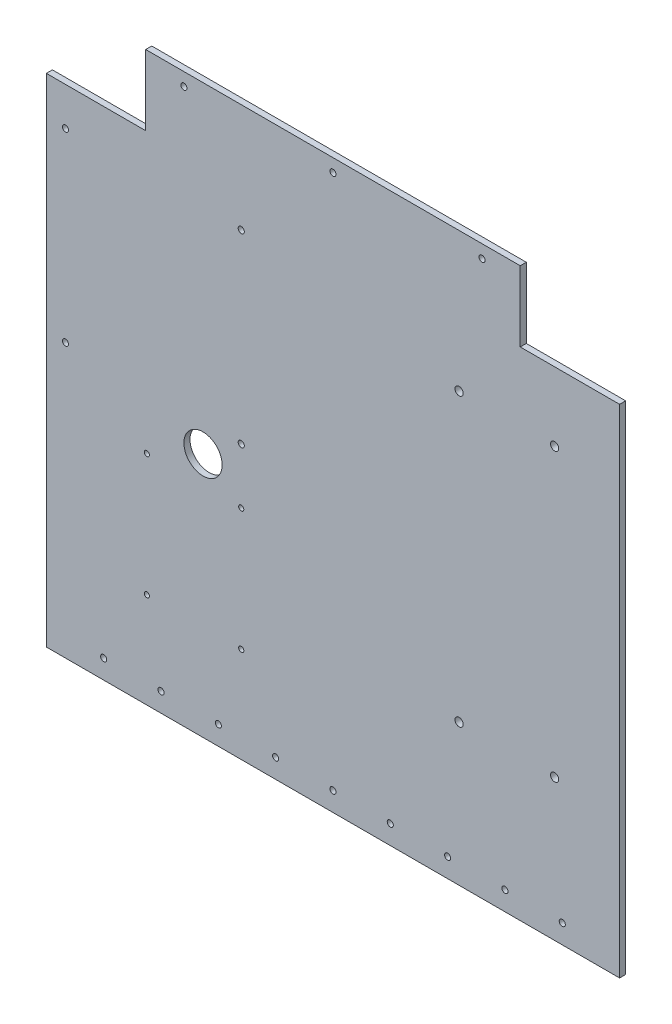
from build123d import *

# Parameters (mm, degrees)
SKETCH1_W                    = 300
SKETCH1_H                    = 300
BOSS_EXTRUDE1_DEPTH          = 3.175
SKETCH2_W                    = 52
SKETCH2_H                    = 40
CUT_EXTRUDE1_DEPTH           = 10
M4_START                     = -3.175
M4_CLEARANCE_HOLE1_OUTLINE_R = 2.15
M4_CLEARANCE_HOLE1_DEPTH     = 3.175
M3_CLEARANCE_HOLE2_D         = 3.2
M2_5_CLEARANCE_HOLE1_D       = 2.7
M3_CLEARANCE_HOLE3_D         = 3.2
M3_CLEARANCE_HOLE4_D         = 3.2
SKETCH14_R                   = 10
CUT_EXTRUDE2_DEPTH           = 10
SKETCH5_W                    = 196
SKETCH5_H                    = 3.2
CUT_EXTRUDE3_DEPTH           = 10


# Read off the part's stored shape, not the designer's step: M4 Clearance Hole1
with BuildPart() as part:
    # Sketch1 → Boss-Extrude1 (new body)
    with BuildSketch(Plane(origin=(0, 0, 0), x_dir=(1, 0, 0), z_dir=(0, 0, -1))):
        with Locations((150, 150)):
            Rectangle(SKETCH1_W, SKETCH1_H)
    extrude(amount=BOSS_EXTRUDE1_DEPTH)

    # Sketch2 → Cut-Extrude1 (cut)
    with BuildSketch(Plane(origin=(0, 0, -3.175), x_dir=(1, 0, 0), z_dir=(0, 0, -1))):
        with Locations((26, 20)):
            Rectangle(SKETCH2_W, SKETCH2_H)
        with Locations((274, 20)):
            Rectangle(SKETCH2_W, SKETCH2_H)
    extrude(amount=-CUT_EXTRUDE1_DEPTH, mode=Mode.SUBTRACT)

    # M4 Clearance Hole1 outline → M4 Clearance Hole1 (cut)
    with BuildSketch(Plane.XY.offset(M4_START)):
        with Locations((266, -226)):
            Circle(M4_CLEARANCE_HOLE1_OUTLINE_R)
        with Locations((216, -76)):
            Circle(M4_CLEARANCE_HOLE1_OUTLINE_R)
        with Locations((216, -226)):
            Circle(M4_CLEARANCE_HOLE1_OUTLINE_R)
        with Locations((266, -76)):
            Circle(M4_CLEARANCE_HOLE1_OUTLINE_R)
    extrude(amount=M4_CLEARANCE_HOLE1_DEPTH, mode=Mode.SUBTRACT)

    # M3 Clearance Hole2 (through all)
    with Locations(Plane(origin=(0, 0, -3.175), x_dir=(-1, 0, 0), z_dir=(0, 0, -1))):
        with Locations((-102, -60), (-10, -157), (-102, -157), (-10, -60)):
            Hole(M3_CLEARANCE_HOLE2_D / 2)

    # M2.5 Clearance Hole1 (through all)
    with Locations(Plane(origin=(0, 0, -3.175), x_dir=(-1, 0, 0), z_dir=(0, 0, -1))):
        with Locations((-102, -186), (-52.6, -250), (-102, -250), (-52.6, -186)):
            Hole(M2_5_CLEARANCE_HOLE1_D / 2)

    # M3 Clearance Hole3 (through all)
    with Locations(Plane(origin=(0, 0, -3.175), x_dir=(-1, 0, 0), z_dir=(0, 0, -1))):
        with Locations((-30, -290), (-270, -290), (-240, -290), (-210, -290), (-180, -290), (-150, -290), (-120, -290), (-90, -290), (-60, -290)):
            Hole(M3_CLEARANCE_HOLE3_D / 2)

    # M3 Clearance Hole4 (through all)
    with Locations(Plane(origin=(0, 0, -3.175), x_dir=(-1, 0, 0), z_dir=(0, 0, -1))):
        with Locations((-72, -10), (-228, -10), (-150, -10)):
            Hole(M3_CLEARANCE_HOLE4_D / 2)

    # Sketch14 → Cut-Extrude2 (cut)
    with BuildSketch(Plane(origin=(0, 0, -3.175), x_dir=(-1, 0, 0), z_dir=(0, 0, -1))):
        with Locations((-82, -171.5)):
            Circle(SKETCH14_R)
    extrude(amount=-CUT_EXTRUDE2_DEPTH, mode=Mode.SUBTRACT)

    # Sketch5 → Cut-Extrude3 (cut)
    with BuildSketch(Plane(origin=(0, 0, -3.175), x_dir=(-1, 0, 0), z_dir=(0, 0, -1))):
        with Locations((-150, -1.6)):
            Rectangle(SKETCH5_W, SKETCH5_H)
    extrude(amount=-CUT_EXTRUDE3_DEPTH, mode=Mode.SUBTRACT)


solid = part.part
